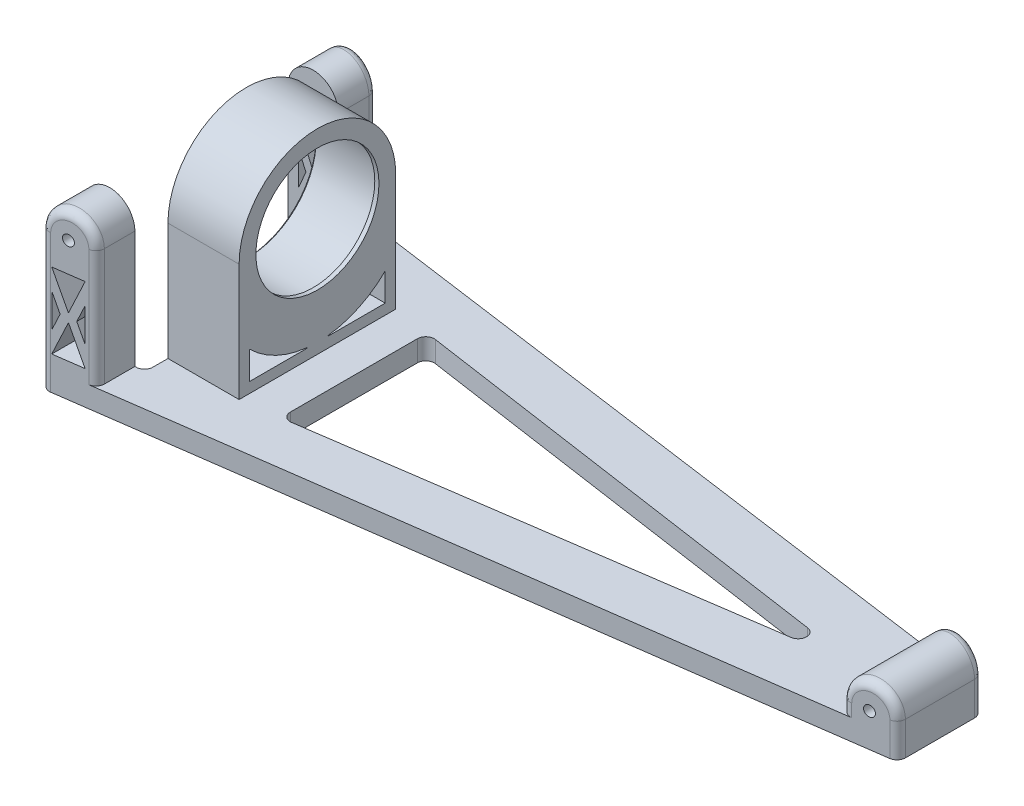
from build123d import *

# Parameters (mm, degrees)
BOSS_EXTRUDE1_DEPTH             = 5
BOSS_EXTRUDE2_REACH             = 185.439
SKETCH2_R                       = 1.25
BOSS_EXTRUDE2_DIRECTION_2_REACH = 185.439
CUT_EXTRUDE1_DEPTH              = 188.472664674
CUT_EXTRUDE1_DEPTH_BACK         = 188.472664674
SKETCH4_W                       = 14.3
SKETCH4_H                       = 48.6
SKETCH5_R                       = 16.2
BOSS_EXTRUDE3_DEPTH             = 16.5
SKETCH7_R                       = 14.7
BOSS_EXTRUDE5_DEPTH             = 0.5
CUT_EXTRUDE2_DEPTH              = 190.224443453
FILLET2_R                       = 2
FILLET5_R                       = 2
CHAMFER1_SIZE                   = 0.5
FILLET6_R                       = 2


with BuildPart() as part:
    # Sketch1 → Boss-Extrude1 (new body)
    with BuildSketch(Plane(origin=(0, 0, 0), x_dir=(1, 0, 0), z_dir=(0, 1, 0))):
        Polygon((0, 35), (0, -35), (180, -10), (180, 10), align=None)
    extrude(amount=BOSS_EXTRUDE1_DEPTH)

    # Boss-Extrude2: up to this plane
    boss_extrude2_end = Plane(origin=(4.769114307, 5, 34.337623013), z_dir=(-0.1375683712746877, 0, -0.9904922731777516))
    # Sketch2 → Boss-Extrude2 (add, up to the surface)
    with BuildSketch(Plane.XY, mode=Mode.PRIVATE) as boss_extrude2_sk1:
        with BuildLine():
            Line((0, 33), (0, 5))
            Line((0, 5), (12, 5))
            Line((12, 5), (12, 33))
            ThreePointArc((12, 33), (6, 39), (0, 33))
        make_face()
        Polygon((2.5, 8), (6, 16), (9.5, 8), align=None, mode=Mode.SUBTRACT)
        Polygon((2.5, 12.989785485), (2.5, 21.010214515), (4.25446885, 17), align=None, mode=Mode.SUBTRACT)
        Polygon((7.74553115, 17), (9.5, 21.010214515), (9.5, 12.989785485), align=None, mode=Mode.SUBTRACT)
        Polygon((6, 18), (2.5, 26), (9.5, 26), align=None, mode=Mode.SUBTRACT)
        with Locations((6, 33)):
            Circle(SKETCH2_R, mode=Mode.SUBTRACT)
    boss_extrude2_tool1 = split(extrude(boss_extrude2_sk1.sketch, amount=BOSS_EXTRUDE2_REACH, mode=Mode.PRIVATE), bisect_by=boss_extrude2_end, keep=Keep.BOTH, mode=Mode.PRIVATE)
    add(boss_extrude2_tool1.solids().sort_by_distance((11.639445, 19, 0))[0])
    # Sketch2 → Boss-Extrude2 (add, up to the surface)
    with BuildSketch(Plane.XY, mode=Mode.PRIVATE) as boss_extrude2_sk2:
        with BuildLine():
            Line((168, 8), (168, 5))
            Line((168, 5), (180, 5))
            Line((180, 5), (180, 8))
            ThreePointArc((180, 8), (174, 14), (168, 8))
        make_face()
        with Locations((174, 8)):
            Circle(SKETCH2_R, mode=Mode.SUBTRACT)
    boss_extrude2_tool2 = split(extrude(boss_extrude2_sk2.sketch, amount=BOSS_EXTRUDE2_REACH, mode=Mode.PRIVATE), bisect_by=boss_extrude2_end, keep=Keep.BOTH, mode=Mode.PRIVATE)
    add(boss_extrude2_tool2.solids().sort_by_distance((168.15, 6.5, 0))[0])

    # Boss-Extrude2 direction 2: up to this plane
    boss_extrude2_direction_2_end = Plane(origin=(4.769114307, 5, -34.337623013), z_dir=(-0.1375683712746877, 0, 0.9904922731777516))
    # Sketch2 → Boss-Extrude2 direction 2 (add, up to the surface)
    with BuildSketch(Plane.XY, mode=Mode.PRIVATE) as boss_extrude2_direction_2_sk1:
        with BuildLine():
            Line((0, 33), (0, 5))
            Line((0, 5), (12, 5))
            Line((12, 5), (12, 33))
            ThreePointArc((12, 33), (6, 39), (0, 33))
        make_face()
        Polygon((2.5, 8), (6, 16), (9.5, 8), align=None, mode=Mode.SUBTRACT)
        Polygon((2.5, 12.989785485), (2.5, 21.010214515), (4.25446885, 17), align=None, mode=Mode.SUBTRACT)
        Polygon((7.74553115, 17), (9.5, 21.010214515), (9.5, 12.989785485), align=None, mode=Mode.SUBTRACT)
        Polygon((6, 18), (2.5, 26), (9.5, 26), align=None, mode=Mode.SUBTRACT)
        with Locations((6, 33)):
            Circle(SKETCH2_R, mode=Mode.SUBTRACT)
    boss_extrude2_direction_2_tool1 = split(extrude(boss_extrude2_direction_2_sk1.sketch, amount=-BOSS_EXTRUDE2_DIRECTION_2_REACH, mode=Mode.PRIVATE), bisect_by=boss_extrude2_direction_2_end, keep=Keep.BOTH, mode=Mode.PRIVATE)
    add(boss_extrude2_direction_2_tool1.solids().sort_by_distance((11.639445, 19, 0))[0])
    # Sketch2 → Boss-Extrude2 direction 2 (add, up to the surface)
    with BuildSketch(Plane.XY, mode=Mode.PRIVATE) as boss_extrude2_direction_2_sk2:
        with BuildLine():
            Line((168, 8), (168, 5))
            Line((168, 5), (180, 5))
            Line((180, 5), (180, 8))
            ThreePointArc((180, 8), (174, 14), (168, 8))
        make_face()
        with Locations((174, 8)):
            Circle(SKETCH2_R, mode=Mode.SUBTRACT)
    boss_extrude2_direction_2_tool2 = split(extrude(boss_extrude2_direction_2_sk2.sketch, amount=-BOSS_EXTRUDE2_DIRECTION_2_REACH, mode=Mode.PRIVATE), bisect_by=boss_extrude2_direction_2_end, keep=Keep.BOTH, mode=Mode.PRIVATE)
    add(boss_extrude2_direction_2_tool2.solids().sort_by_distance((168.15, 6.5, 0))[0])

    # Sketch4 → Cut-Extrude1 (cut, two sides: drawn at the far end of the back side and taken through both)
    with BuildSketch(Plane(origin=(0, 0, 0), x_dir=(1, 0, 0), z_dir=(0, 1, 0)).offset(-CUT_EXTRUDE1_DEPTH_BACK)):
        with Locations((7.15, 0)):
            Rectangle(SKETCH4_W, SKETCH4_H)
    extrude(amount=CUT_EXTRUDE1_DEPTH + CUT_EXTRUDE1_DEPTH_BACK, mode=Mode.SUBTRACT)

    # Sketch5 → Boss-Extrude3 (add)
    with BuildSketch(Plane.ZY.offset(-14.3)):
        with BuildLine():
            Line((-18.7, 33), (-18.7, 5))
            Line((-18.7, 5), (18.7, 5))
            Line((18.7, 5), (18.7, 33))
            ThreePointArc((18.7, 33), (0, 51.7), (-18.7, 33))
        make_face()
        with BuildLine():
            Line((-2.5, 7.5), (-16.2, 7.5))
            Line((-16.2, 7.5), (-16.2, 14.173334694))
            ThreePointArc((-16.2, 14.173334694), (-9.90483685, 9.7420086), (-2.5, 7.63627327))
            Line((-2.5, 7.63627327), (-2.5, 7.5))
        make_face(mode=Mode.SUBTRACT)
        with BuildLine():
            Line((16.2, 14.173334694), (16.2, 7.5))
            Line((16.2, 7.5), (2.5, 7.5))
            Line((2.5, 7.5), (2.5, 7.63627327))
            ThreePointArc((2.5, 7.63627327), (9.90483685, 9.7420086), (16.2, 14.173334694))
        make_face(mode=Mode.SUBTRACT)
        with Locations((0, 33)):
            Circle(SKETCH5_R, mode=Mode.SUBTRACT)
    extrude(amount=-BOSS_EXTRUDE3_DEPTH)

    # Sketch7 → Boss-Extrude5 (add, symmetric)
    with BuildSketch(Plane(origin=(30.8, 0, 0), x_dir=(0, 0, -1), z_dir=(1, 0, 0))):
        with BuildLine():
            ThreePointArc((18.7, 33), (0, 51.7), (-18.7, 33))
            Line((-18.7, 33), (-18.7, 5))
            Line((-18.7, 5), (18.7, 5))
            Line((18.7, 5), (18.7, 33))
        make_face()
        with BuildLine():
            Line((-2.5, 7.63627327), (-2.5, 7.5))
            Line((-2.5, 7.5), (-16.2, 7.5))
            Line((-16.2, 7.5), (-16.2, 14.173334694))
            ThreePointArc((-16.2, 14.173334694), (-9.90483685, 9.7420086), (-2.5, 7.63627327))
        make_face(mode=Mode.SUBTRACT)
        with BuildLine():
            ThreePointArc((2.5, 7.63627327), (9.90483685, 9.7420086), (16.2, 14.173334694))
            Line((16.2, 14.173334694), (16.2, 7.5))
            Line((16.2, 7.5), (2.5, 7.5))
            Line((2.5, 7.5), (2.5, 7.63627327))
        make_face(mode=Mode.SUBTRACT)
        with Locations((0, 33)):
            Circle(SKETCH7_R, mode=Mode.SUBTRACT)
    extrude(amount=BOSS_EXTRUDE5_DEPTH, both=True)

    # Sketch8 → Cut-Extrude2 (cut, through all)
    with BuildSketch(Plane(origin=(0, 5, 0), x_dir=(1, 0, 0), z_dir=(0, 1, 0))):
        Polygon((40, 17.5), (40, -17.5), (160, 0), align=None)
    extrude(amount=-CUT_EXTRUDE2_DEPTH, mode=Mode.SUBTRACT)

    # Fillet2
    fillet2_edges = [part.edges().sort_by_distance(p)[0] for p in [
        (160, 2.5, 0),
        (40, 2.5, 17.5),
        (40, 2.5, -17.5),
    ]]
    fillet(fillet2_edges, radius=FILLET2_R)

    # Fillet5
    fillet5_edges = [part.edges().sort_by_distance(p)[0] for p in [
        (14.3, 2.5, 24.3),
        (14.3, 2.5, -24.3),
    ]]
    fillet(fillet5_edges, radius=FILLET5_R)

    # Chamfer1
    chamfer1_edges = [part.edges().sort_by_distance(p)[0] for p in [
        (14.3, 33, -16.2),
    ]]
    chamfer(chamfer1_edges, length=CHAMFER1_SIZE)

    # Fillet6
    fillet6_edges = [part.edges().sort_by_distance(p)[0] for p in [
        (180, 4, -10),
        (168, 6.5, -11.666666667),
        (180, 4, 10),
        (168, 6.5, 11.666666667),
        (12, 19, -33.333333333),
        (0, 16.5, -35),
        (12, 19, 33.333333333),
        (0, 16.5, 35),
        (174, 14, -10.833333333),
        (174, 14, 10.833333333),
        (6, 39, -34.166666667),
        (6, 39, 34.166666667),
    ]]
    fillet(fillet6_edges, radius=FILLET6_R)


solid = part.part
